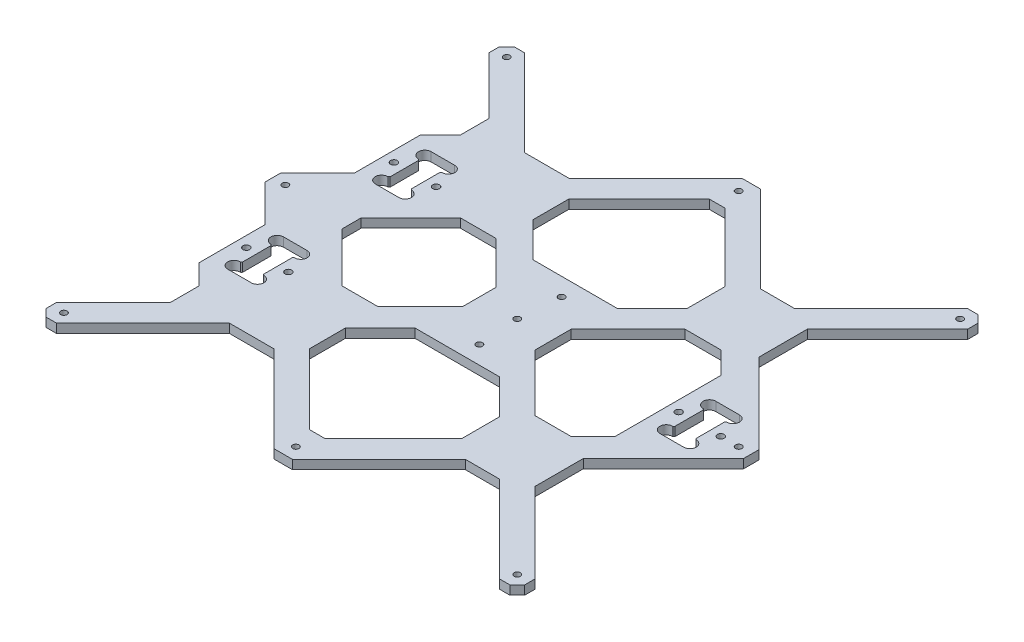
from build123d import *

# Parameters (mm, degrees)
SKETCH2_R           = 1.5
SKETCH2_R_2         = 1.6
BOSS_EXTRUDE2_DEPTH = 4.25


with BuildPart() as part:
    # Sketch2 → Boss-Extrude2 (new body)
    with BuildSketch(Plane(origin=(0, 0, 0), x_dir=(1, 0, 0), z_dir=(0, 1, 0))):
        Polygon((225.400116, 255), (184.400116, 296), (175.599884, 296), (134.599884, 255), (113.485281374, 255), (72.485281374, 296), (67.514830223, 296), (64, 292.485169777), (64, 287.514718626), (91, 260.514718626), (91, 247), (81.5, 237.5), (81.5, 206.239105), (64, 188.739105), (64, 181.260895), (81.5, 163.760895), (81.5, 132.5), (91, 123), (91, 109.485281374), (64, 82.485281374), (64, 77.514830223), (67.514830223, 74), (72.485281374, 74), (113.485281374, 115), (134.599884, 115), (175.599884, 74), (184.400116, 74), (225.400116, 115), (241.514718626, 115), (282.514718626, 74), (287.485169777, 74), (291, 77.514830223), (291, 82.485281374), (253, 120.485281374), (253, 143.333039), (291, 181.333039), (291, 188.666961), (253, 226.666961), (253, 249.514718626), (291, 287.514718626), (291, 292.485169777), (287.485169777, 296), (282.514718626, 296), (241.514718626, 255), align=None)
        with Locations((70, 80)):
            Circle(SKETCH2_R, mode=Mode.SUBTRACT)
        with Locations((180, 80)):
            Circle(SKETCH2_R, mode=Mode.SUBTRACT)
        with Locations((86.5, 150)):
            Circle(SKETCH2_R_2, mode=Mode.SUBTRACT)
        with Locations((70, 185)):
            Circle(SKETCH2_R, mode=Mode.SUBTRACT)
        Polygon((176.317383, 90.266846), (143, 123.584229), (143, 140.433686), (159.566314, 157), (199.51474, 157), (216, 140.51474), (216, 122.570419884), (183.682617, 90.253036884), align=None, mode=Mode.SUBTRACT)
        with BuildLine():
            Line((102.000000013, 157.25), (101.500000013, 156.75))
            Line((101.500000013, 156.75), (101.500000013, 143.25))
            Line((101.500000013, 143.25), (102.000000013, 142.75))
            Line((102.000000013, 142.75), (102.100000157, 142.75))
            ThreePointArc((102.100000157, 142.75), (105.1, 139.75), (102.100000157, 136.75))
            Line((102.100000157, 136.75), (90.899999843, 136.75))
            ThreePointArc((90.899999843, 136.75), (87.9, 139.75), (90.899999843, 142.75))
            Line((90.899999843, 142.75), (90.999999987, 142.75))
            Line((90.999999987, 142.75), (91.499999987, 143.25))
            Line((91.499999987, 143.25), (91.499999987, 156.75))
            Line((91.499999987, 156.75), (90.999999987, 157.25))
            Line((90.999999987, 157.25), (90.899999843, 157.25))
            ThreePointArc((90.899999843, 157.25), (87.9, 160.25), (90.899999843, 163.25))
            Line((90.899999843, 163.25), (102.100000157, 163.25))
            ThreePointArc((102.100000157, 163.25), (105.100000157, 160.25), (102.100000157, 157.25))
            Line((102.100000157, 157.25), (102.000000013, 157.25))
        make_face(mode=Mode.SUBTRACT)
        with Locations((106.5, 150)):
            Circle(SKETCH2_R_2, mode=Mode.SUBTRACT)
        with Locations((181.5, 165.5)):
            Circle(SKETCH2_R, mode=Mode.SUBTRACT)
        with Locations((285, 80)):
            Circle(SKETCH2_R, mode=Mode.SUBTRACT)
        with Locations((86.5, 220)):
            Circle(SKETCH2_R_2, mode=Mode.SUBTRACT)
        Polygon((162, 192.97703218), (162, 177.02296782), (141.97703218, 157), (124.999970007, 157), (101.5, 180.5), (101.5, 189.5), (124.999970007, 213), (141.97703218, 213), align=None, mode=Mode.SUBTRACT)
        with BuildLine():
            Line((102.000000013, 227.25), (101.500000013, 226.75))
            Line((101.500000013, 226.75), (101.500000013, 213.25))
            Line((101.500000013, 213.25), (102.000000013, 212.75))
            Line((102.000000013, 212.75), (102.100000157, 212.75))
            ThreePointArc((102.100000157, 212.75), (105.1, 209.75), (102.100000157, 206.75))
            Line((102.100000157, 206.75), (90.899999843, 206.75))
            ThreePointArc((90.899999843, 206.75), (87.9, 209.75), (90.899999843, 212.75))
            Line((90.899999843, 212.75), (90.999999987, 212.75))
            Line((90.999999987, 212.75), (91.499999987, 213.25))
            Line((91.499999987, 213.25), (91.499999987, 226.75))
            Line((91.499999987, 226.75), (90.999999987, 227.25))
            Line((90.999999987, 227.25), (90.899999843, 227.25))
            ThreePointArc((90.899999843, 227.25), (87.9, 230.25), (90.899999843, 233.25))
            Line((90.899999843, 233.25), (102.100000157, 233.25))
            ThreePointArc((102.100000157, 233.25), (105.100000157, 230.25), (102.100000157, 227.25))
            Line((102.100000157, 227.25), (102.000000013, 227.25))
        make_face(mode=Mode.SUBTRACT)
        with Locations((106.5, 220)):
            Circle(SKETCH2_R_2, mode=Mode.SUBTRACT)
        with Locations((180, 185)):
            Circle(SKETCH2_R, mode=Mode.SUBTRACT)
        with Locations((181.5, 204.5)):
            Circle(SKETCH2_R, mode=Mode.SUBTRACT)
        Polygon((143, 229.566314), (143, 246.415771), (176.317383, 279.733154), (183.682617, 279.746963116), (216, 247.429580116), (216, 229.48526), (199.51474, 213), (159.566314, 213), align=None, mode=Mode.SUBTRACT)
        with Locations((70, 290)):
            Circle(SKETCH2_R, mode=Mode.SUBTRACT)
        with Locations((180, 290)):
            Circle(SKETCH2_R, mode=Mode.SUBTRACT)
        Polygon((240.98529, 220.529449), (251.5, 210.014709), (251.5, 159.985291), (240.98529, 149.470551), (224.014709, 149.470551), (197, 176.48526), (197, 193.51474), (224.014709, 220.529449), align=None, mode=Mode.SUBTRACT)
        with Locations((256.5, 185)):
            Circle(SKETCH2_R_2, mode=Mode.SUBTRACT)
        with BuildLine():
            Line((272.000000013, 192.25), (271.500000013, 191.75))
            Line((271.500000013, 191.75), (271.500000013, 178.25))
            Line((271.500000013, 178.25), (272.000000013, 177.75))
            Line((272.000000013, 177.75), (272.100000157, 177.75))
            ThreePointArc((272.100000157, 177.75), (275.100000157, 174.75), (272.100000157, 171.75))
            Line((272.100000157, 171.75), (260.899999843, 171.75))
            ThreePointArc((260.899999843, 171.75), (257.9, 174.75), (260.899999843, 177.75))
            Line((260.899999843, 177.75), (260.999999987, 177.75))
            Line((260.999999987, 177.75), (261.499999987, 178.25))
            Line((261.499999987, 178.25), (261.499999987, 191.75))
            Line((261.499999987, 191.75), (260.999999987, 192.25))
            Line((260.999999987, 192.25), (260.899999843, 192.25))
            ThreePointArc((260.899999843, 192.25), (257.9, 195.25), (260.899999843, 198.25))
            Line((260.899999843, 198.25), (272.100000157, 198.25))
            ThreePointArc((272.100000157, 198.25), (275.100000157, 195.25), (272.100000157, 192.25))
            Line((272.100000157, 192.25), (272.000000013, 192.25))
        make_face(mode=Mode.SUBTRACT)
        with Locations((276.5, 185)):
            Circle(SKETCH2_R_2, mode=Mode.SUBTRACT)
        with Locations((285, 185)):
            Circle(SKETCH2_R, mode=Mode.SUBTRACT)
        with Locations((285, 290)):
            Circle(SKETCH2_R, mode=Mode.SUBTRACT)
    extrude(amount=BOSS_EXTRUDE2_DEPTH)


solid = part.part
